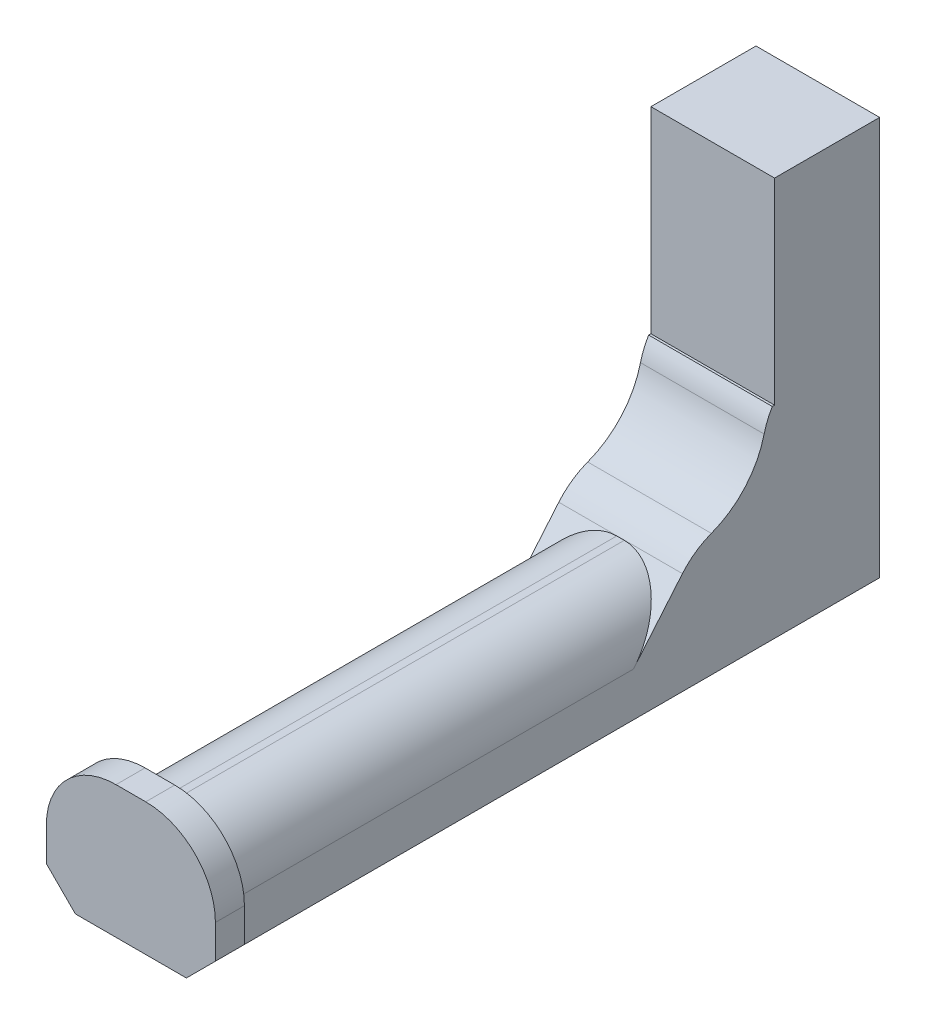
from build123d import *

# Parameters (mm, degrees)
SKETCH1_W           = 21.3
SKETCH1_H           = 70
BOSS_EXTRUDE1_DEPTH = 3
BOSS_EXTRUDE2_DEPTH = 15.1
SKETCH3_W           = 15.400000000000002
SKETCH3_H           = 3
BOSS_EXTRUDE3_DEPTH = 15.1
BOSS_EXTRUDE4_DEPTH = 95
BOSS_EXTRUDE5_DEPTH = 5
SKETCH9_W           = 21.3
SKETCH9_H           = 17.22200087142766
BOSS_EXTRUDE6_DEPTH = 16.000000000000007
SKETCH12_R          = 14.60799399049553
CUT_EXTRUDE1_DEPTH  = 109.85245207766768
CHAMFER4_SIZE       = 1
CHAMFER5_SIZE       = 5
CHAMFER6_SIZE       = 5
FILLET4_R           = 12
FILLET5_R           = 12
FILLET6_R           = 12
FILLET7_R           = 10


with BuildPart() as part:
    # Sketch1 → Boss-Extrude1 (new body)
    with BuildSketch(Plane.XY):
        Rectangle(SKETCH1_W, SKETCH1_H)
    extrude(amount=-BOSS_EXTRUDE1_DEPTH)

    # Sketch2 → Boss-Extrude2 (add)
    with BuildSketch(Plane(origin=(0, 0, -3), x_dir=(-1, 0, 0), z_dir=(0, 0, -1))):
        Polygon((-10.649999999999999, 35), (-7.700000000000009, 35), (-7.700000000000002, -35), (-10.649999999999999, -35), align=None)
        Polygon((10.650000000000002, 35), (7.699999999999991, 35), (7.699999999999998, -35), (10.650000000000002, -35), align=None)
    extrude(amount=BOSS_EXTRUDE2_DEPTH)

    # Sketch3 → Boss-Extrude3 (add)
    with BuildSketch(Plane(origin=(0, 0, -3), x_dir=(-1, 0, 0), z_dir=(0, 0, -1))):
        with Locations((-9.33e-15, 33.5)):
            Rectangle(SKETCH3_W, SKETCH3_H)
    extrude(amount=BOSS_EXTRUDE3_DEPTH)

    # Sketch4 → Boss-Extrude4 (add)
    with BuildSketch(Plane.XY):
        Polygon((-10.650000000000002, -16.099065593181194), (10.649999999999999, -16.099065593181194), (10.650000000000007, -35), (-10.649999999999993, -35), align=None)
    extrude(amount=BOSS_EXTRUDE4_DEPTH)

    # Sketch6 → Boss-Extrude5 (add)
    with BuildSketch(Plane.XY.offset(95)):
        Polygon((-14.790899735714902, -12.21473987671473), (14.327115992863071, -12.21473987671473), (14.327115992863074, -35), (-14.790899735714893, -35), align=None)
    extrude(amount=BOSS_EXTRUDE5_DEPTH)

    # Sketch9 → Boss-Extrude6 (add)
    with BuildSketch(Plane.XY):
        with Locations((-1.78e-15, -7.488065157467364)):
            Rectangle(SKETCH9_W, SKETCH9_H)
    extrude(amount=BOSS_EXTRUDE6_DEPTH)

    # Sketch12 → Cut-Extrude1 (cut, through all)
    with BuildSketch(Plane.ZY.offset(10.650000000000002)):
        with Locations((16.000000000000007, 1.122935278246466)):
            Circle(SKETCH12_R)
    extrude(amount=-CUT_EXTRUDE1_DEPTH, mode=Mode.SUBTRACT)

    # Chamfer3
    # the kernel refuses this chamfer: 3 mm, written as the material it takes off along each edge
    with BuildSketch(Plane(origin=(17.73850714382705, -13.485058712249064, 16.000000000000007), x_dir=(0, 0.08550168468531993, -0.9963380259309449), z_dir=(-1, 0, 0))) as chamfer3_piece_1_section:
        with BuildLine():
            Line((2.582869005863168, -0.08485281374238583), (-0.31934564535848514, 2.817361837479259))
            Line((-0.31934564535848514, 2.817361837479259), (-0.37912592691434055, 2.81223173639814))
            ThreePointArc((-0.37912592691434055, 2.81223173639814), (-0.18095110257164257, 1.4068549031398474), (-0.05978028155585542, -0.00513010108111909))
            Line((-0.05978028155585542, -0.00513010108111909), (0.00513010108111924, -0.05978028155585719))
            ThreePointArc((0.00513010108111924, -0.05978028155585719), (1.2915393356537215, -0.00656807524010173), (2.5777389047820485, -0.1446330952982423))
            Line((2.5777389047820485, -0.1446330952982423), (2.582869005863168, -0.08485281374238583))
        make_face()
    chamfer3_piece_1 = extrude(amount=35.4770142876541, mode=Mode.PRIVATE)
    chamfer3_piece_1 = split(chamfer3_piece_1, bisect_by=Plane(origin=(17.73850714382705, -16.099065593181194, 16.000000000000007), z_dir=(0, 1, 0)), keep=Keep.TOP, mode=Mode.PRIVATE)
    add(chamfer3_piece_1, mode=Mode.SUBTRACT)

    # Chamfer4
    # the kernel refuses this chamfer: 1 mm, written as the material it takes off along each edge
    with BuildSketch(Plane(origin=(13.31779092299838, 1.122935278246466, 1.3920060095044775), x_dir=(0, -0.9993692754635791, 0.0355112835504551), z_dir=(-1, 0, 0))) as chamfer4_piece_1:
        with BuildLine():
            Line((1.0374972333996406, 1e-17), (-CHAMFER4_SIZE * 0.0355112835505, -CHAMFER4_SIZE * 0.999369275464))
            Line((-CHAMFER4_SIZE * 0.0355112835505, -CHAMFER4_SIZE * 0.999369275464), (0, 0))
            ThreePointArc((0, 0), (0.5334069539111667, -0.00920626580887721), (1.0374972333996406, 1e-17))
        make_face()
    extrude(amount=26.63558184599676, mode=Mode.SUBTRACT)

    # Chamfer5
    chamfer5_edges = [part.edges().sort_by_distance(p)[0] for p in [
        (-14.790899735714893, -35, 97.5),
    ]]
    chamfer(chamfer5_edges, length=CHAMFER5_SIZE)

    # Chamfer6
    chamfer6_edges = [part.edges().sort_by_distance(p)[0] for p in [
        (14.327115992863074, -35, 97.5),
    ]]
    chamfer(chamfer6_edges, length=CHAMFER6_SIZE)

    # Fillet4
    fillet4_edges = [part.edges().sort_by_distance(p)[0] for p in [
        (14.327115992863071, -12.21473987671473, 97.5),
        (-14.790899735714902, -12.21473987671473, 97.5),
    ]]
    fillet(fillet4_edges, radius=FILLET4_R)

    # Fillet5
    fillet5_edges = [part.edges().sort_by_distance(p)[0] for p in [
        (-1.78e-15, -13.271474119451348, 13.511131478397797),
    ]]
    fillet(fillet5_edges, radius=FILLET5_R)

    # Fillet6
    # the kernel refuses this fillet: 12 mm, written as the material it takes off along each edge
    with BuildSketch(Plane(origin=(16.66324146618684, 0.086092419807557, 1.428848867941594), x_dir=(0, -0.9882482751789802, 0.15285727527916634), z_dir=(-1, 0, 0))) as fillet6_piece_1:
        with BuildLine():
            CenterArc((3.393233706942116, -11.959263365525597), FILLET6_R, 94.7223972339899, 17.695866700852164)
            Line((-1.1831471407174274, -0.8661691922493711), (-1.274674757670618, -0.6443073087838466))
            ThreePointArc((-1.274674757670618, -0.6443073087838466), (-0.7333441241917547, -0.2394325626577685), (-0.1417705538330419, 0.19365203346691875))
            Line((-0.1417705538330419, 0.19365203346691875), (0.01975874240954748, 0.23918526731049536))
            ThreePointArc((0.01975874240954748, 0.23918526731049536), (1.2026482932374447, 0.19040995736707406), (2.38553784406539, 0.23918526731051196))
            Line((2.38553784406539, 0.23918526731051196), (2.405296586474737, 0))
        make_face()
    extrude(amount=33.32648293237368, mode=Mode.SUBTRACT)

    # Fillet7
    fillet7_edges = [part.edges().sort_by_distance(p)[0] for p in [
        (-10.650000000000002, -16.099065593181095, 55.44588674849325),
        (10.649999999999999, -16.099065593181095, 55.44588674849325),
    ]]
    fillet(fillet7_edges, radius=FILLET7_R)


solid = part.part
